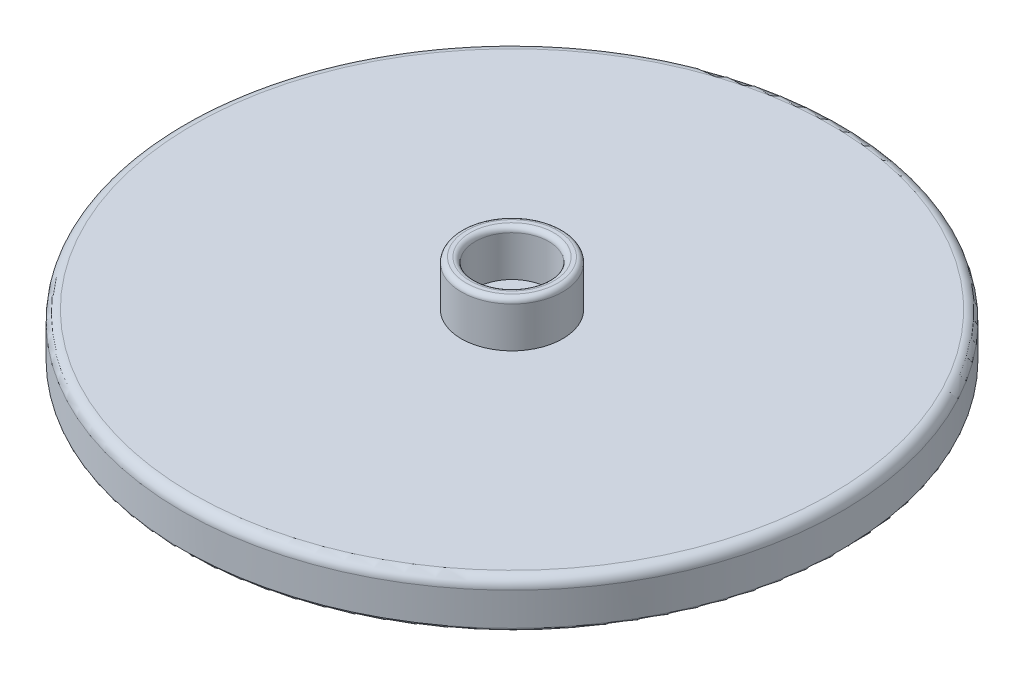
from build123d import *

# Parameters (mm, degrees)
SKETCH1_R           = 65
BOSS_EXTRUDE1_DEPTH = 9
SKETCH2_R           = 10
BOSS_EXTRUDE2_DEPTH = 9
SKETCH3_R           = 7.25
CUT_EXTRUDE1_DEPTH  = 9
CUT_EXTRUDE2_DEPTH  = 0.5
FILLET1_R           = 0.5
FILLET2_R           = 2
FILLET3_R           = 1


with BuildPart() as part:
    # Sketch1 → Boss-Extrude1 (new body)
    with BuildSketch(Plane(origin=(0, 0, 0), x_dir=(1, 0, 0), z_dir=(0, 1, 0))):
        with Locations(Location((54.111665284, 0, 0), (0, 0, 270))):
            Circle(SKETCH1_R)
    extrude(amount=BOSS_EXTRUDE1_DEPTH)

    # Sketch2 → Boss-Extrude2 (add)
    with BuildSketch(Plane(origin=(0, 9, 0), x_dir=(1, 0, 0), z_dir=(0, 1, 0))):
        with Locations(Location((54.111665284, 0, 0), (0, 0, 270))):
            Circle(SKETCH2_R)
    extrude(amount=BOSS_EXTRUDE2_DEPTH)

    # Sketch3 → Cut-Extrude1 (cut)
    with BuildSketch(Plane(origin=(0, 18, 0), x_dir=(1, 0, 0), z_dir=(0, 1, 0))):
        with Locations(Location((54.111665284, 0, 0), (0, 0, 270))):
            Circle(SKETCH3_R)
    extrude(amount=-CUT_EXTRUDE1_DEPTH, mode=Mode.SUBTRACT)

    # Sketch4 → Cut-Extrude2 (cut)
    with BuildSketch(Plane.XZ):
        with BuildLine():
            Line((-21.399913382, 1.5), (-7.388334716, 1.5))
            ThreePointArc((-7.388334716, 1.5), (35.038072155, 19.073593129), (52.611665284, 61.5))
            Line((52.611665284, 61.5), (52.611665284, 70.134963097))
            Line((52.611665284, 70.134963097), (55.611665284, 70.134963097))
            Line((55.611665284, 70.134963097), (55.611665284, 61.5))
            ThreePointArc((55.611665284, 61.5), (73.185258413, 19.073593129), (115.611665284, 1.5))
            Line((115.611665284, 1.5), (129.62324395, 1.5))
            Line((129.62324395, 1.5), (129.62324395, -1.5))
            Line((129.62324395, -1.5), (115.611665284, -1.5))
            ThreePointArc((115.611665284, -1.5), (73.185258413, -19.073593129), (55.611665284, -61.5))
            Line((55.611665284, -61.5), (55.611665284, -70.134963097))
            Line((55.611665284, -70.134963097), (52.611665284, -70.134963097))
            Line((52.611665284, -70.134963097), (52.611665284, -61.5))
            ThreePointArc((52.611665284, -61.5), (35.038072155, -19.073593129), (-7.388334716, -1.5))
            Line((-7.388334716, -1.5), (-21.399913382, -1.5))
            Line((-21.399913382, -1.5), (-21.399913382, 1.5))
        make_face()
    extrude(amount=-CUT_EXTRUDE2_DEPTH, mode=Mode.SUBTRACT)

    # Fillet1
    fillet1_edges = [part.edges().sort_by_distance(p)[0] for p in [
        (117.353010285, 0, 1.5),
        (55.611665284, 0, 63.241345001),
        (100.073606061, 0, 45.961940777),
        (52.611665284, 0, 63.241345001),
        (-9.129679717, 0, 1.5),
        (8.149724507, 0, 45.961940777),
        (-9.129679717, 0, -1.5),
        (52.611665284, 0, -63.241345001),
        (8.149724507, 0, -45.961940777),
        (55.611665284, 0, -63.241345001),
        (117.353010285, 0, -1.5),
        (100.073606061, 0, -45.961940777),
        (73.185258413, 0, 19.073593129),
        (73.185258413, 0, -19.073593129),
        (35.038072155, 0, -19.073593129),
        (35.038072155, 0, 19.073593129),
    ]]
    fillet(fillet1_edges, radius=FILLET1_R - 0.0001)  # a hair under: the kernel refuses the full size

    # Fillet2
    fillet2_edges = [part.edges().sort_by_distance(p)[0] for p in [
        (54.111665284, 9, -65),
    ]]
    fillet(fillet2_edges, radius=FILLET2_R)

    # Fillet3
    fillet3_edges = [part.edges().sort_by_distance(p)[0] for p in [
        (54.111665284, 18, -7.25),
        (54.111665284, 18, -10),
    ]]
    fillet(fillet3_edges, radius=FILLET3_R)


solid = part.part
